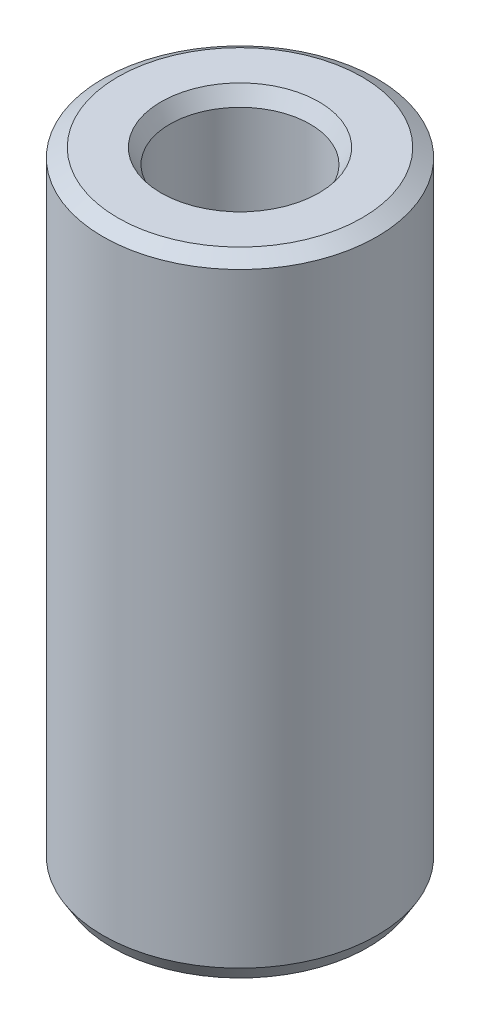
from build123d import *
from OCP.BRepFilletAPI import BRepFilletAPI_MakeChamfer

# Parameters (mm, degrees)
SKETCH1_R           = 7.5
BOSS_EXTRUDE1_DEPTH = 34.435379068
SKETCH2_R           = 3.835185967
CUT_EXTRUDE1_DEPTH  = 37.031865502
CHAMFER1_SIZE       = 0.490340486
CHAMFER1_SIZE2      = 0.811019929


with BuildPart() as part:
    # Sketch1 → Boss-Extrude1 (new body)
    with BuildSketch(Plane(origin=(0, 0, 0), x_dir=(1, 0, 0), z_dir=(0, 1, 0))):
        Circle(SKETCH1_R)
    extrude(amount=BOSS_EXTRUDE1_DEPTH)

    # Sketch2 → Cut-Extrude1 (cut, through all)
    with BuildSketch(Plane(origin=(0, 0, 0), x_dir=(1, 0, 0), z_dir=(0, 1, 0))):
        Circle(SKETCH2_R)
    extrude(amount=CUT_EXTRUDE1_DEPTH, mode=Mode.SUBTRACT)

    # Chamfer1: one chamfer whose edges measure the first distance from different faces: ONE call of the kernel's chamfer builder (chamfer() names one face for all edges)
    chamfer1_edges_1 = [part.edges().sort_by_distance(p)[0] for p in [
        (-3.835185967, 34.435379068, 0),
    ]]
    chamfer1_side_1 = [part.faces().sort_by_distance(p)[0] for p in [
        (-7.287867966, 34.435379068, 0),
    ]]
    chamfer1_edges_2 = [part.edges().sort_by_distance(p)[0] for p in [
        (-3.835185967, 0, 0),
    ]]
    chamfer1_side_2 = [part.faces().sort_by_distance(p)[0] for p in [
        (-3.835185967, 17.217689534, 0),
    ]]
    chamfer1_edges_3 = [part.edges().sort_by_distance(p)[0] for p in [
        (-7.5, 0, 0),
    ]]
    chamfer1_side_3 = [part.faces().sort_by_distance(p)[0] for p in [
        (-7.287867966, 0, 0),
    ]]
    chamfer1_edges_4 = [part.edges().sort_by_distance(p)[0] for p in [
        (-7.5, 34.435379068, 0),
    ]]
    chamfer1_side_4 = [part.faces().sort_by_distance(p)[0] for p in [
        (-7.5, 17.217689534, 0),
    ]]
    chamfer1 = BRepFilletAPI_MakeChamfer(part.part.solid().wrapped)
    for e in chamfer1_edges_1:
        chamfer1.Add(CHAMFER1_SIZE, CHAMFER1_SIZE2, e.wrapped, chamfer1_side_1[0].wrapped)  # the first distance lies on this face
    for e in chamfer1_edges_2:
        chamfer1.Add(CHAMFER1_SIZE, CHAMFER1_SIZE2, e.wrapped, chamfer1_side_2[0].wrapped)  # the first distance lies on this face
    for e in chamfer1_edges_3:
        chamfer1.Add(CHAMFER1_SIZE, CHAMFER1_SIZE2, e.wrapped, chamfer1_side_3[0].wrapped)  # the first distance lies on this face
    for e in chamfer1_edges_4:
        chamfer1.Add(CHAMFER1_SIZE, CHAMFER1_SIZE2, e.wrapped, chamfer1_side_4[0].wrapped)  # the first distance lies on this face
    add(Compound.cast(chamfer1.Shape()), mode=Mode.REPLACE)


solid = part.part
